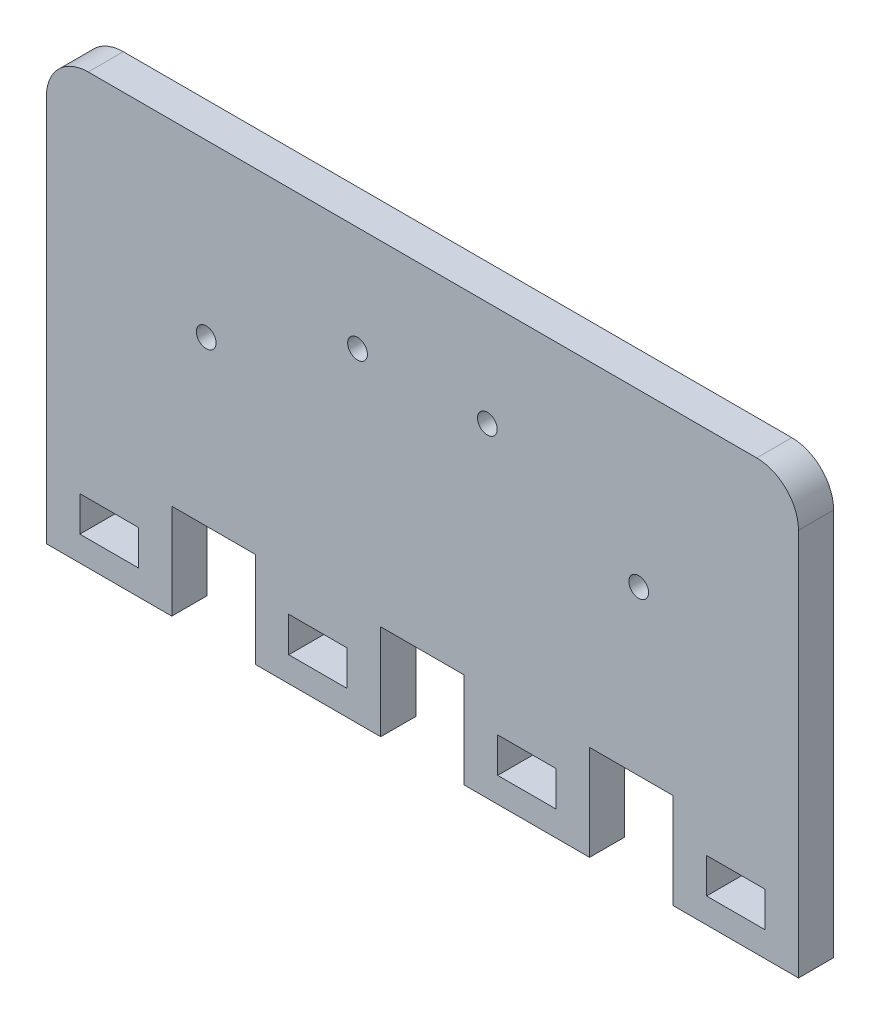
from build123d import *

# Parameters (mm, degrees)
SKETCH1_W           = 114.3
SKETCH1_H           = 56.134
BOSS_EXTRUDE1_DEPTH = 5.334
SKETCH2_W           = 12.7
SKETCH2_H           = 5.334
CUT_EXTRUDE1_DEPTH  = 90.417531181
FILLET1_R           = 6.35
SKETCH3_R           = 1.5
CUT_EXTRUDE2_DEPTH  = 90.417531181
SKETCH4_W           = 19.05
SKETCH4_H           = 5.334
BOSS_EXTRUDE2_DEPTH = 9.144
SKETCH6_W           = 8.89
SKETCH6_H           = 5.334
CUT_EXTRUDE3_DEPTH  = 93.966642796


with BuildPart() as part:
    # Sketch1 → Boss-Extrude1 (new body)
    with BuildSketch(Plane.XY):
        with Locations((26.61749153, -2.755892293)):
            Rectangle(SKETCH1_W, SKETCH1_H)
    extrude(amount=BOSS_EXTRUDE1_DEPTH)

    # Sketch2 → Cut-Extrude1 (cut, through all)
    with BuildSketch(Plane.XY.offset(5.334)):
        with Locations((-5.13250847, -28.155892293)):
            Rectangle(SKETCH2_W, SKETCH2_H)
        with Locations((26.61749153, -28.155892293)):
            Rectangle(SKETCH2_W, SKETCH2_H)
        with Locations((58.36749153, -28.155892293)):
            Rectangle(SKETCH2_W, SKETCH2_H)
    extrude(amount=-CUT_EXTRUDE1_DEPTH, mode=Mode.SUBTRACT)

    # Fillet1
    fillet1_edges = [part.edges().sort_by_distance(p)[0] for p in [
        (83.76749153, 25.311107707, 2.667),
        (-30.53250847, 25.311107707, 2.667),
    ]]
    fillet(fillet1_edges, radius=FILLET1_R)

    # Sketch3 → Cut-Extrude2 (cut, through all)
    with BuildSketch(Plane(origin=(0, 0, 0), x_dir=(-1, 0, 0), z_dir=(0, 0, -1))):
        with Locations((6.24850847, -0.644892293)):
            Circle(SKETCH3_R)
        with Locations((-16.75149153, 9.355107707)):
            Circle(SKETCH3_R)
        with Locations((-59.48349153, -0.644892293)):
            Circle(SKETCH3_R)
        with Locations((-36.48349153, 9.355107707)):
            Circle(SKETCH3_R)
    extrude(amount=-CUT_EXTRUDE2_DEPTH, mode=Mode.SUBTRACT)

    # Sketch4 → Boss-Extrude2 (add)
    with BuildSketch(Plane(origin=(0, -30.822892293, 0), x_dir=(-1, 0, 0), z_dir=(0, -1, 0))):
        with Locations((-10.74249153, -2.667)):
            Rectangle(SKETCH4_W, SKETCH4_H)
        with Locations((21.00750847, -2.667)):
            Rectangle(SKETCH4_W, SKETCH4_H)
        with Locations((-42.49249153, -2.667)):
            Rectangle(SKETCH4_W, SKETCH4_H)
        with Locations((-74.24249153, -2.667)):
            Rectangle(SKETCH4_W, SKETCH4_H)
    extrude(amount=BOSS_EXTRUDE2_DEPTH)

    # Sketch6 → Cut-Extrude3 (cut, through all)
    with BuildSketch(Plane.XY.offset(5.334)):
        with Locations((-21.00750847, -33.489892293)):
            Rectangle(SKETCH6_W, SKETCH6_H)
        with Locations((10.74249153, -33.489892293)):
            Rectangle(SKETCH6_W, SKETCH6_H)
        with Locations((42.49249153, -33.489892293)):
            Rectangle(SKETCH6_W, SKETCH6_H)
        with Locations((74.24249153, -33.489892293)):
            Rectangle(SKETCH6_W, SKETCH6_H)
    extrude(amount=-CUT_EXTRUDE3_DEPTH, mode=Mode.SUBTRACT)


solid = part.part
